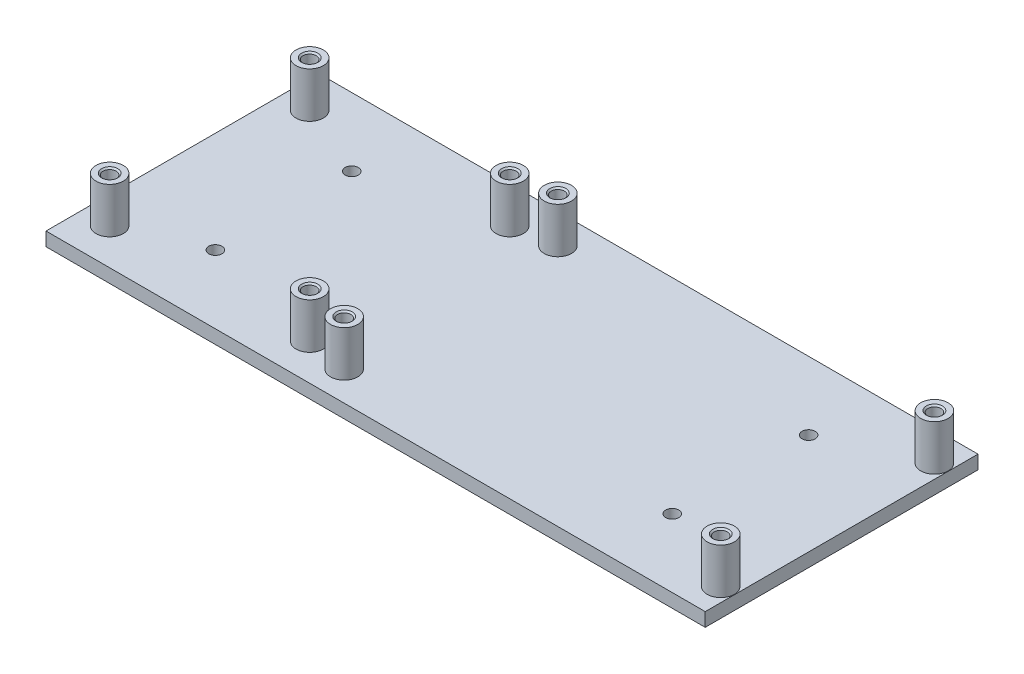
from build123d import *

# Parameters (mm, degrees)
SKETCH_1_W                     = 145
SKETCH_1_H                     = 60
EXTRUDE_1_DEPTH                = 3
SKETCH_3_R                     = 3
EXTRUDE_2_DEPTH                = 10
HOLE_WIZARD_M3_5_4_D           = 2.9
HOLE_WIZARD_M3_5_4_DEPTH       = 11.2
HOLE_WIZARD_M3_5_4_CSINK_D     = 3.55
HOLE_WIZARD_M3_5_4_CSINK_ANGLE = 90
HOLE_WIZARD_M3_5_4_TIP         = 0.871247898
HOLE_WIZARD_M3_5_5_D           = 2.9
HOLE_WIZARD_M3_5_5_DEPTH       = 7
HOLE_WIZARD_M3_5_5_CSINK_D     = 3.55
HOLE_WIZARD_M3_5_5_CSINK_ANGLE = 90
HOLE_WIZARD_M3_5_5_TIP         = 0.871247898


with BuildPart() as part:
    # 草图1 → 凸台-拉伸1 (new body)
    with BuildSketch(Plane(origin=(0, 0, 0), x_dir=(1, 0, 0), z_dir=(0, 1, 0))):
        with Locations((72.5, 30)):
            Rectangle(SKETCH_1_W, SKETCH_1_H)
    extrude(amount=EXTRUDE_1_DEPTH)

    # 草图3 → 凸台-拉伸2 (add)
    with BuildSketch(Plane(origin=(0, 3, 0), x_dir=(1, 0, 0), z_dir=(0, 1, 0))):
        with Locations((59.085, 53.5)):
            Circle(SKETCH_3_R)
        with Locations((59.085, 6.5)):
            Circle(SKETCH_3_R)
        with Locations((141.915, 6.5)):
            Circle(SKETCH_3_R)
        with Locations((141.915, 53.5)):
            Circle(SKETCH_3_R)
        with Locations((6, 52)):
            Circle(SKETCH_3_R)
        with Locations((50, 52)):
            Circle(SKETCH_3_R)
        with Locations((6, 8)):
            Circle(SKETCH_3_R)
        with Locations((50, 8)):
            Circle(SKETCH_3_R)
    extrude(amount=EXTRUDE_2_DEPTH)

    # M3.5 螺纹孔4
    with Locations(Plane(origin=(0, 13, 0), x_dir=(1, 0, 0), z_dir=(0, 1, 0))):
        with Locations((141.915, 53.5), (6, 52), (50, 52), (59.085, 53.5), (50, 8), (6, 8), (141.915, 6.5), (59.085, 6.5)):
            CounterSinkHole(HOLE_WIZARD_M3_5_4_D / 2, HOLE_WIZARD_M3_5_4_CSINK_D / 2, depth=HOLE_WIZARD_M3_5_4_DEPTH, counter_sink_angle=HOLE_WIZARD_M3_5_4_CSINK_ANGLE)
            with Locations((0, 0, -(HOLE_WIZARD_M3_5_4_DEPTH + HOLE_WIZARD_M3_5_4_TIP / 2))):  # 118° drill point
                Cone(0, HOLE_WIZARD_M3_5_4_D / 2, HOLE_WIZARD_M3_5_4_TIP, mode=Mode.SUBTRACT)

    # M3.5 螺纹孔5
    with Locations(Plane.XZ):
        with Locations((22.25, -45), (22.25, -15), (122.75, -15), (122.75, -45)):
            CounterSinkHole(HOLE_WIZARD_M3_5_5_D / 2, HOLE_WIZARD_M3_5_5_CSINK_D / 2, depth=HOLE_WIZARD_M3_5_5_DEPTH, counter_sink_angle=HOLE_WIZARD_M3_5_5_CSINK_ANGLE)
            with Locations((0, 0, -(HOLE_WIZARD_M3_5_5_DEPTH + HOLE_WIZARD_M3_5_5_TIP / 2))):  # 118° drill point
                Cone(0, HOLE_WIZARD_M3_5_5_D / 2, HOLE_WIZARD_M3_5_5_TIP, mode=Mode.SUBTRACT)


solid = part.part
